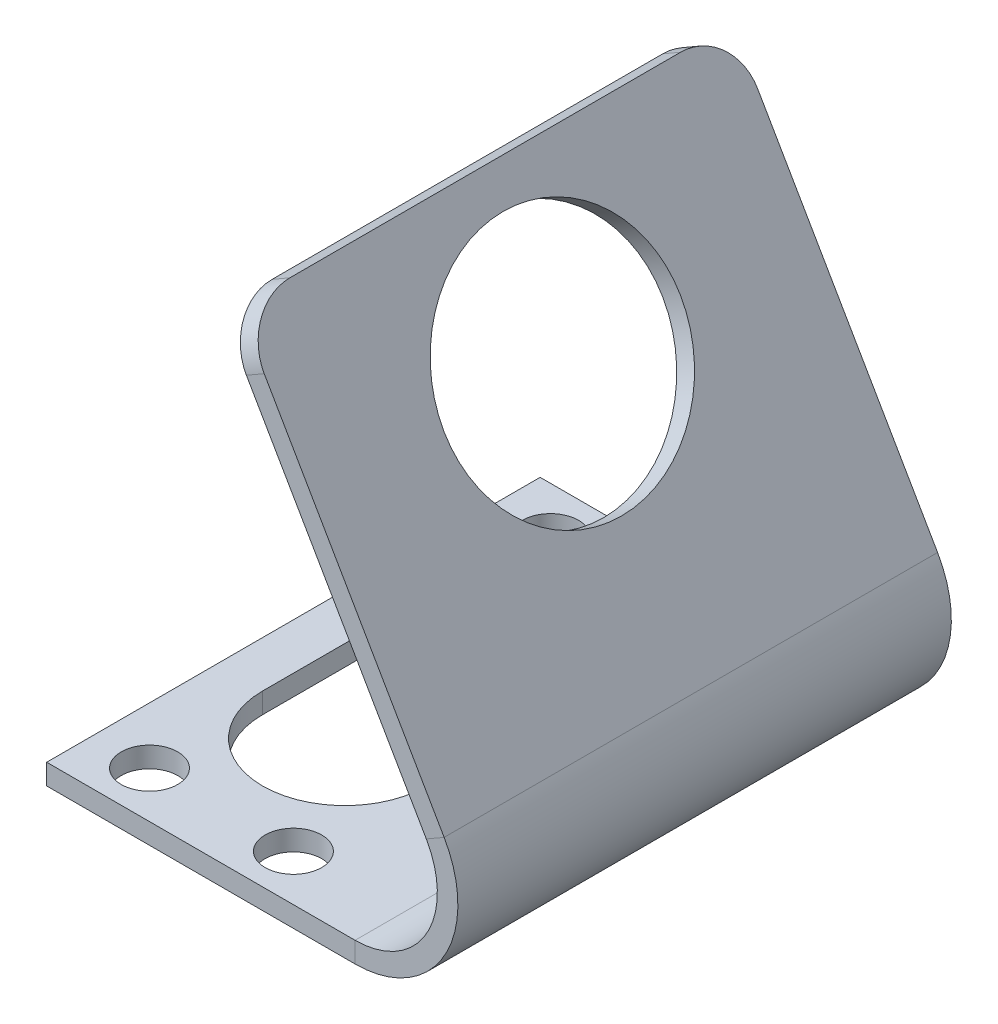
from build123d import *

# Parameters (mm, degrees)
SM_BASE_FLANGE_1_DEPTH = 24
SKETCH_3_R             = 2.75
CUT_EXTRUDE_1_DEPTH    = 2
SKETCH_4_R             = 11.5
CUT_EXTRUDE_2_DEPTH    = 2
FILLET_1_R             = 5
CUT_EXTRUDE_3_DEPTH    = 2


# Sheet-metal steps are written as plain solids
with BuildPart() as part:
    # Sketch 1 → 基体-法兰1 (new, symmetric)
    with BuildSketch(Plane.XY):
        with BuildLine():
            Line((-30, 0), (0, 0))
            ThreePointArc((0, 0), (8.660254038, 5), (8.660254038, 15))
            Line((8.660254038, 15), (-11.339745962, 49.641016151))
            Line((-11.339745962, 49.641016151), (-13.07179677, 48.641016151))
            Line((-13.07179677, 48.641016151), (6.92820323, 14))
            ThreePointArc((6.92820323, 14), (6.92820323, 6), (0, 2))
            Line((0, 2), (-30, 2))
            Line((-30, 2), (-30, 0))
        make_face()
    extrude(amount=SM_BASE_FLANGE_1_DEPTH, both=True)

    # 草图3 → 切除-拉伸1 (cut)
    with BuildSketch(Plane.XZ):
        with Locations(Location((-24.5, 19.5, 0), (0, 0, 270))):
            Circle(SKETCH_3_R)
        with Locations(Location((-10.5, 19.5, 0), (0, 0, 270))):
            Circle(SKETCH_3_R)
        with Locations(Location((-10.5, -19.5, 0), (0, 0, 90))):
            Circle(SKETCH_3_R)
        with Locations(Location((-24.5, -19.5, 0), (0, 0, 90))):
            Circle(SKETCH_3_R)
    extrude(amount=-CUT_EXTRUDE_1_DEPTH, mode=Mode.SUBTRACT)

    # 草图4 → 切除-拉伸2 (cut)
    with BuildSketch(Plane(origin=(12.990381057, 7.5, 0), x_dir=(0, 0, -1), z_dir=(0.8660254037844363, 0.5000000000000041, 0))):
        with Locations(Location((0, 33.660254038, 0), (0, 0, 90))):
            Circle(SKETCH_4_R)
    extrude(amount=-CUT_EXTRUDE_2_DEPTH, mode=Mode.SUBTRACT)

    # 圆角1
    fillet_1_edges = [part.edges().sort_by_distance(p)[0] for p in [
        (-12.205771366, 49.141016151, 24),
        (-12.205771366, 49.141016151, -24),
    ]]
    fillet(fillet_1_edges, radius=FILLET_1_R)

    # 草图5 → 切除-拉伸3 (cut)
    with BuildSketch(Plane.XZ):
        with BuildLine():
            Line((-9.5, 7.5), (-9.5, -7.5))
            ThreePointArc((-9.5, -7.5), (-17.5, -15.5), (-25.5, -7.5))
            Line((-25.5, -7.5), (-25.5, 7.5))
            ThreePointArc((-25.5, 7.5), (-17.5, 15.5), (-9.5, 7.5))
        make_face()
    extrude(amount=-CUT_EXTRUDE_3_DEPTH, mode=Mode.SUBTRACT)


solid = part.part
